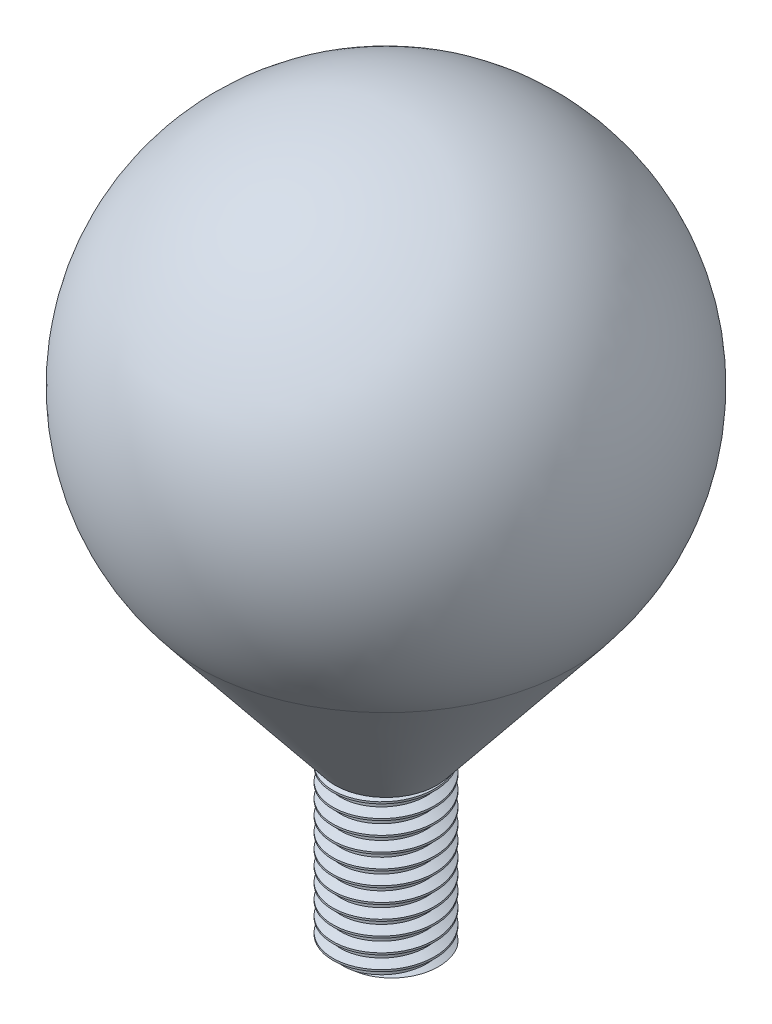
from build123d import *

# Parameters (mm, degrees)
THREAD2_PITCH = 0.907142857


with BuildPart() as part:
    # Sketch1 → Revolve1 (revolve)
    with BuildSketch(Plane.XY, mode=Mode.PRIVATE) as revolve1_sk:
        with BuildLine():
            Line((-3.175, -20), (-3.175, -30))
            Line((-3.175, -30), (0, -30))
            Line((0, -30), (0, 15))
            ThreePointArc((0, 15), (-13.525944906, 6.484505717), (-11.694542277, -9.393491414))
            Line((-11.694542277, -9.393491414), (-3.175, -20))
        make_face()
    revolve(revolve1_sk.sketch.rotate(Axis((0, -260.464421806, 0), (0, 1, 0)), 180), axis=Axis((0, -260.464421806, 0), (0, 1, 0)))

    # Thread2: the profile of Thread Profile2 profile screwed along a right-hand helix of 12.125984 turns, 8 arcs to a turn; built about Z, then put on its axis
    thread2_z = Axis((0, 0, 0), (0, 0, 1))
    thread2_corners = [(3.1753, 0, -0.000173205), (3.1753, 0, 0.793923203), (2.683994528, 0, 0.510267856), (2.683994528, 0, 0.283482142)]
    with BuildLine(mode=Mode.PRIVATE) as thread2_profile:
        Line(thread2_corners[0], thread2_corners[1])
        Line(thread2_corners[1], thread2_corners[2])
        Line(thread2_corners[2], thread2_corners[3])
        Line(thread2_corners[3], thread2_corners[0])
    thread2_cap = Face(thread2_profile.wire())
    thread2_turn_angles = [0, 22.5, 45, 67.5, 90, 112.5, 135, 157.5, 180, 202.5, 225, 247.5, 270, 292.5, 315, 337.5, 360]
    thread2_turn_weights = [1, 0.9238795325112867, 1, 0.9238795325112867, 1, 0.9238795325112867, 1, 0.9238795325112867, 1, 0.9238795325112867, 1, 0.9238795325112867, 1, 0.9238795325112867, 1, 0.9238795325112867, 1]
    thread2_turn_rails = [Edge.make_bspline([Vector(p[0], p[1], 0).rotate(thread2_z, thread2_turn_angles[k]) / thread2_turn_weights[k] + Vector(0, 0, p[2] + THREAD2_PITCH * thread2_turn_angles[k] / 360) for k in range(17)], [0, 0, 0, 1, 1, 2, 2, 3, 3, 4, 4, 5, 5, 6, 6, 7, 7, 8, 8, 8], 2, thread2_turn_weights) for p in thread2_corners]
    thread2_turn_sides = [Face.make_surface_from_curves(thread2_turn_rails[p[0]], thread2_turn_rails[p[1]]) for p in [(0, 1), (1, 2), (2, 3), (3, 0)]]
    thread2_last_angles = [4320, 4342.5, 4365, 4365.177165354, 4365.354330709]
    thread2_last_weights = [1, 0.9238795325112867, 1, 0.999995219404616, 1]
    thread2_last_rails = [Edge.make_bspline([Vector(p[0], p[1], 0).rotate(thread2_z, thread2_last_angles[k]) / thread2_last_weights[k] + Vector(0, 0, p[2] + THREAD2_PITCH * thread2_last_angles[k] / 360) for k in range(5)], [0, 0, 0, 1, 1, 2, 2, 2], 2, thread2_last_weights) for p in thread2_corners]
    thread2_last_sides = [Face.make_surface_from_curves(thread2_last_rails[p[0]], thread2_last_rails[p[1]]) for p in [(0, 1), (1, 2), (2, 3), (3, 0)]]
    thread2 = Plane(origin=(0, -31, 0), x_dir=(1, 0, 0), z_dir=(0, 1, 0)) * Solid(Shell([*[p.moved(Location((0, 0, THREAD2_PITCH * i))) for i in range(12) for p in thread2_turn_sides], *thread2_last_sides, thread2_cap, thread2_cap.rotate(thread2_z, 4365.354330709).moved(Location((0, 0, THREAD2_PITCH * 4365.354330709 / 360)))]))
    add(thread2, mode=Mode.SUBTRACT)


solid = part.part
